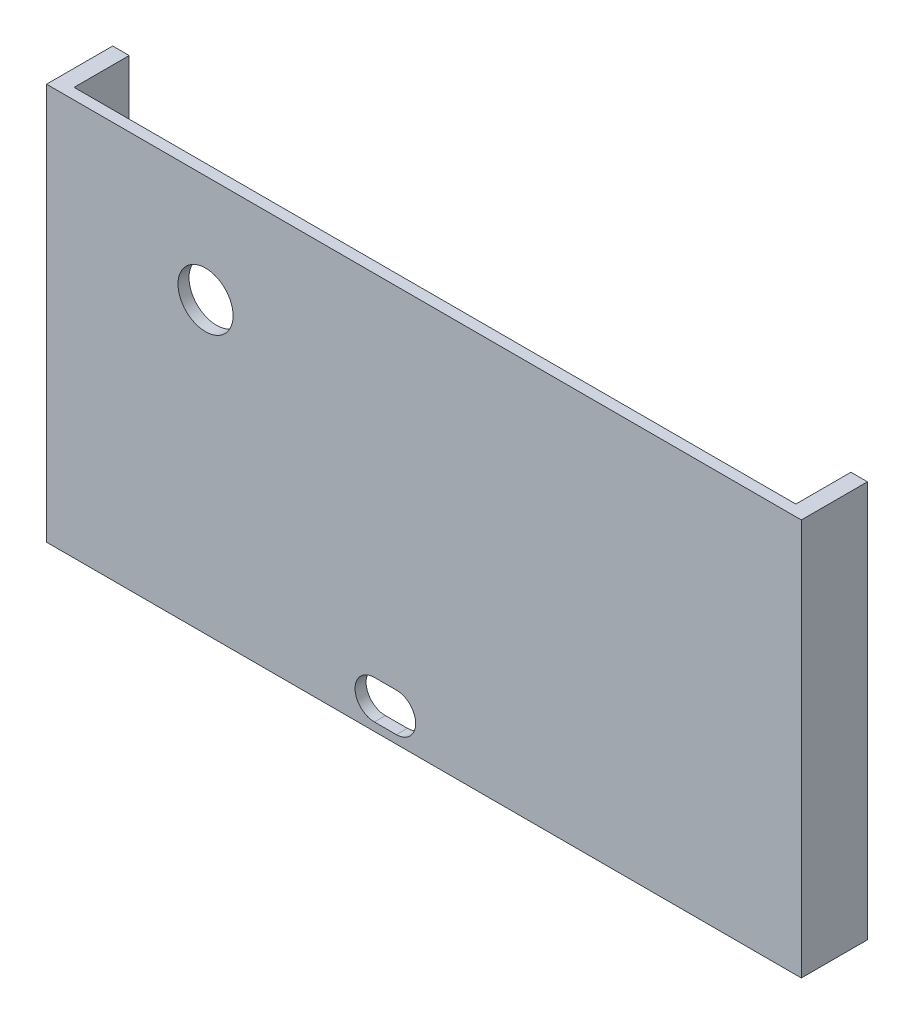
from build123d import *

# Parameters (mm, degrees)
SKETCH_1_W          = 137
SKETCH_1_H          = 72
EXTRUDE_1_DEPTH     = 2
SKETCH_13_R         = 5
CUT_EXTRUDE_3_DEPTH = 10
SKETCH_14_R         = 1
EXTRUDE_8_DEPTH     = 5
CUT_EXTRUDE_4_DEPTH = 5
EXTRUDE_9_DEPTH     = 10


with BuildPart() as part:
    # 草图1 → 凸台-拉伸1 (new body)
    with BuildSketch(Plane.XY):
        with Locations((23.663043478, 5.112122186)):
            Rectangle(SKETCH_1_W, SKETCH_1_H)
    extrude(amount=EXTRUDE_1_DEPTH)

    # 草图13 → 切除-拉伸3 (cut)
    with BuildSketch(Plane.XY.offset(2)):
        with Locations((-15.979181362, 21.631548394)):
            Circle(SKETCH_13_R)
    extrude(amount=-CUT_EXTRUDE_3_DEPTH, mode=Mode.SUBTRACT)

    # 草图14 → 凸台-拉伸8 (add)
    with BuildSketch(Plane(origin=(0, 0, 0), x_dir=(-1, 0, 0), z_dir=(0, 0, -1))):
        with Locations((10.979181362, 26.631548394)):
            Circle(SKETCH_14_R)
        with Locations((20.979181362, 26.631548394)):
            Circle(SKETCH_14_R)
    extrude(amount=EXTRUDE_8_DEPTH)

    # 草图15 → 切除-拉伸4 (cut)
    with BuildSketch(Plane.XY.offset(2)):
        with BuildLine():
            Line((14.664855072, -22.387877814), (18.664855072, -22.387877814))
            ThreePointArc((18.664855072, -22.387877814), (22.164855072, -25.887877814), (18.664855072, -29.387877814))
            Line((18.664855072, -29.387877814), (14.664855072, -29.387877814))
            ThreePointArc((14.664855072, -29.387877814), (11.164855072, -25.887877814), (14.664855072, -22.387877814))
        make_face()
    extrude(amount=-CUT_EXTRUDE_4_DEPTH, mode=Mode.SUBTRACT)

    # 草图18 → 凸台-拉伸9 (add)
    with BuildSketch(Plane(origin=(0, 0, 0), x_dir=(-1, 0, 0), z_dir=(0, 0, -1))):
        Polygon((-89.163043478, 38.112122186), (-89.163043478, -27.887877814), (-89.163043478, -30.887877814), (-92.163043478, -30.887877814), (-92.163043478, 41.112122186), (-89.163043478, 41.112122186), align=None)
        Polygon((44.836956522, 41.112122186), (44.836956522, -30.887877814), (41.836956522, -30.887877814), (41.836956522, -27.887877814), (41.836956522, 38.112122186), (41.836956522, 41.112122186), align=None)
    extrude(amount=EXTRUDE_9_DEPTH)


solid = part.part
